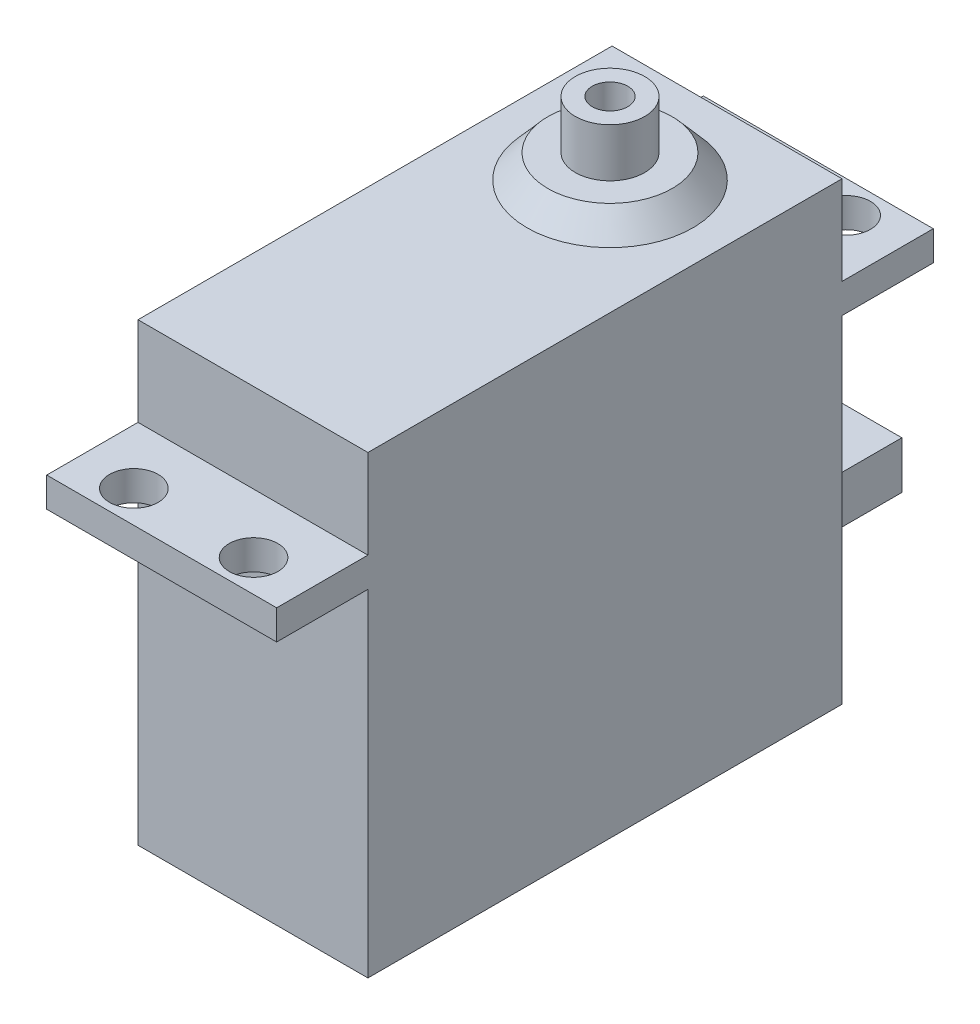
from build123d import *

# Parameters (mm, degrees)
SKETCH_1_W          = 19.4
SKETCH_1_H          = 7.7
SKETCH_1_R          = 2.05
SKETCH_1_H_2        = 40
EXTRUDE_1_DEPTH     = 2.5
SKETCH_1_3_W        = 19.4
SKETCH_1_3_H        = 40
EXTRUDE_2_DEPTH     = 28.4
EXTRUDE_START       = 2.5
SKETCH_1_4_W        = 19.4
SKETCH_1_4_H        = 40
EXTRUDE_3_DEPTH     = 7.5
SKETCH_2_R          = 2.925
EXTRUDE_4_DEPTH     = 6.1
SKETCH_4_2_R        = 4
EXTRUDE_5_DEPTH     = 1
SKETCH_6_R          = 7
SKETCH_7_R          = 5.25
SKETCH_8_R          = 1.5
CUT_EXTRUDE_1_DEPTH = 6.1
CUT_EXTRUDE_START   = -4
SKETCH_9_R          = 1.5
CUT_EXTRUDE_2_DEPTH = 4
SKETCH_10_W         = 8
SKETCH_10_H         = 6
EXTRUDE_6_DEPTH     = 2
SKETCH_11_W         = 5.5
SKETCH_11_H         = 4
EXTRUDE_7_DEPTH     = 10


with BuildPart() as part:
    # 스케치1 → 보스-돌출1 (new body)
    # profile 1 of 3: a face of its own
    with BuildSketch(Plane(origin=(0, 0, 0), x_dir=(1, 0, 0), z_dir=(0, 1, 0))):
        with Locations((0, 23.85)):
            Rectangle(SKETCH_1_W, SKETCH_1_H)
        with Locations(Location((-5.05, 25, 0), (0, 0, 270))):
            Circle(SKETCH_1_R, mode=Mode.SUBTRACT)
        with Locations(Location((5.05, 25, 0), (0, 0, 270))):
            Circle(SKETCH_1_R, mode=Mode.SUBTRACT)
    # profile 2 of 3: a face of its own
    with BuildSketch(Plane(origin=(0, 0, 0), x_dir=(1, 0, 0), z_dir=(0, 1, 0))):
        Rectangle(SKETCH_1_W, SKETCH_1_H_2)
    # profile 3 of 3: a face of its own
    with BuildSketch(Plane(origin=(0, 0, 0), x_dir=(1, 0, 0), z_dir=(0, 1, 0))):
        with Locations((0, -23.85)):
            Rectangle(SKETCH_1_W, SKETCH_1_H)
        with Locations(Location((-5.05, -25, 0), (0, 0, 270))):
            Circle(SKETCH_1_R, mode=Mode.SUBTRACT)
        with Locations(Location((5.05, -25, 0), (0, 0, 270))):
            Circle(SKETCH_1_R, mode=Mode.SUBTRACT)
    extrude(amount=EXTRUDE_1_DEPTH)

    # 스케치1<3> → 보스-돌출2 (add)
    with BuildSketch(Plane(origin=(0, 0, 0), x_dir=(1, 0, 0), z_dir=(0, 1, 0))):
        Rectangle(SKETCH_1_3_W, SKETCH_1_3_H)
    extrude(amount=-EXTRUDE_2_DEPTH)

    # 스케치1<4> → 보스-돌출3 (add)
    with BuildSketch(Plane(origin=(0, 0, 0), x_dir=(1, 0, 0), z_dir=(0, 1, 0)).offset(EXTRUDE_START)):
        Rectangle(SKETCH_1_4_W, SKETCH_1_4_H)
    extrude(amount=EXTRUDE_3_DEPTH)

    # 스케치2 → 보스-돌출4 (add)
    with BuildSketch(Plane(origin=(0, 10, 0), x_dir=(1, 0, 0), z_dir=(0, 1, 0))):
        with Locations(Location((0, 10.125, 0), (0, 0, 90))):
            Circle(SKETCH_2_R)
    extrude(amount=EXTRUDE_4_DEPTH)

    # 로프트1: read off the stored shape, not the designer's step
    # 로프트1: loft between two sections, ruled curve by curve
    loft_1_from = [
        Edge.make_bspline([(1.462551233, -28.4, -3.279494621), (-12.228459525, -28.4, -0.354392156), (-15.15356199, -28.4, -14.045402913), (-1.462551233, -28.4, -16.970505379), (12.228459525, -28.4, -19.895607844), (15.15356199, -28.4, -6.204597087), (1.462551233, -28.4, -3.279494621)], [0, 0, 0, 0, 0.5, 0.5, 0.5, 1, 1, 1, 1], 3, [1, 0.333333333, 0.333333333, 1, 0.333333333, 0.333333333, 1]),
    ]
    loft_1_to = [
        Edge.make_bspline([(2.267005586, -31.4, -6.829444557), (-4.3241053, -31.4, -2.295433386), (-8.858116471, -31.4, -8.886544271), (-2.267005586, -31.4, -13.420555443), (4.3241053, -31.4, -17.954566614), (8.858116471, -31.4, -11.363455729), (2.267005586, -31.4, -6.829444557)], [0, 0, 0, 0, 0.5, 0.5, 0.5, 1, 1, 1, 1], 3, [1, 0.333333333, 0.333333333, 1, 0.333333333, 0.333333333, 1]),
    ]
    loft_1 = Solid(Shell([*[Face.make_surface_from_curves(loft_1_from[k], loft_1_to[k]) for k in range(1)], Face(Wire(loft_1_from)), Face(Wire(loft_1_to))]))
    add(loft_1)

    # 스케치4<2> → 보스-돌출5 (add)
    with BuildSketch(Plane(origin=(0, -31.4, 0), x_dir=(-1, 0, 0), z_dir=(0, -1, 0))):
        with Locations(Location((0, 10.125, 0), (0, 0, 235.476))):
            Circle(SKETCH_4_2_R)
    extrude(amount=EXTRUDE_5_DEPTH)

    # 스케치6 → 로프트2 section 0
    with BuildSketch(Plane(origin=(0, 10, 0), x_dir=(1, 0, 0), z_dir=(0, 1, 0))):
        with Locations((0, 10.125)):
            Circle(SKETCH_6_R)
    # 스케치7 → 로프트2 section 1
    with BuildSketch(Plane(origin=(0, 12, 0), x_dir=(1, 0, 0), z_dir=(0, 1, 0))):
        with Locations((0, 10.125)):
            Circle(SKETCH_7_R)
    loft()

    # 스케치8 → 컷-돌출1 (cut)
    with BuildSketch(Plane(origin=(0, 16.1, 0), x_dir=(1, 0, 0), z_dir=(0, 1, 0))):
        with Locations(Location((0, 10.125, 0), (0, 0, 270))):
            Circle(SKETCH_8_R)
    extrude(amount=-CUT_EXTRUDE_1_DEPTH, mode=Mode.SUBTRACT)

    # 스케치9 → 컷-돌출2 (cut)
    with BuildSketch(Plane.XZ.offset(32.4).offset(CUT_EXTRUDE_START)):
        with Locations(Location((0, -10.125, 0), (0, 0, 90))):
            Circle(SKETCH_9_R)
    extrude(amount=CUT_EXTRUDE_2_DEPTH, mode=Mode.SUBTRACT)

    # 스케치10 → 보스-돌출6 (add)
    with BuildSketch(Plane(origin=(0, 0, -20), x_dir=(-1, 0, 0), z_dir=(0, 0, -1))):
        with Locations((0, -20.4)):
            Rectangle(SKETCH_10_W, SKETCH_10_H)
    extrude(amount=EXTRUDE_6_DEPTH)

    # 스케치11 → 보스-돌출7 (add)
    with BuildSketch(Plane(origin=(0, 0, -22), x_dir=(-1, 0, 0), z_dir=(0, 0, -1))):
        with Locations((0, -20.4)):
            Rectangle(SKETCH_11_W, SKETCH_11_H)
    extrude(amount=EXTRUDE_7_DEPTH)


solid = part.part
